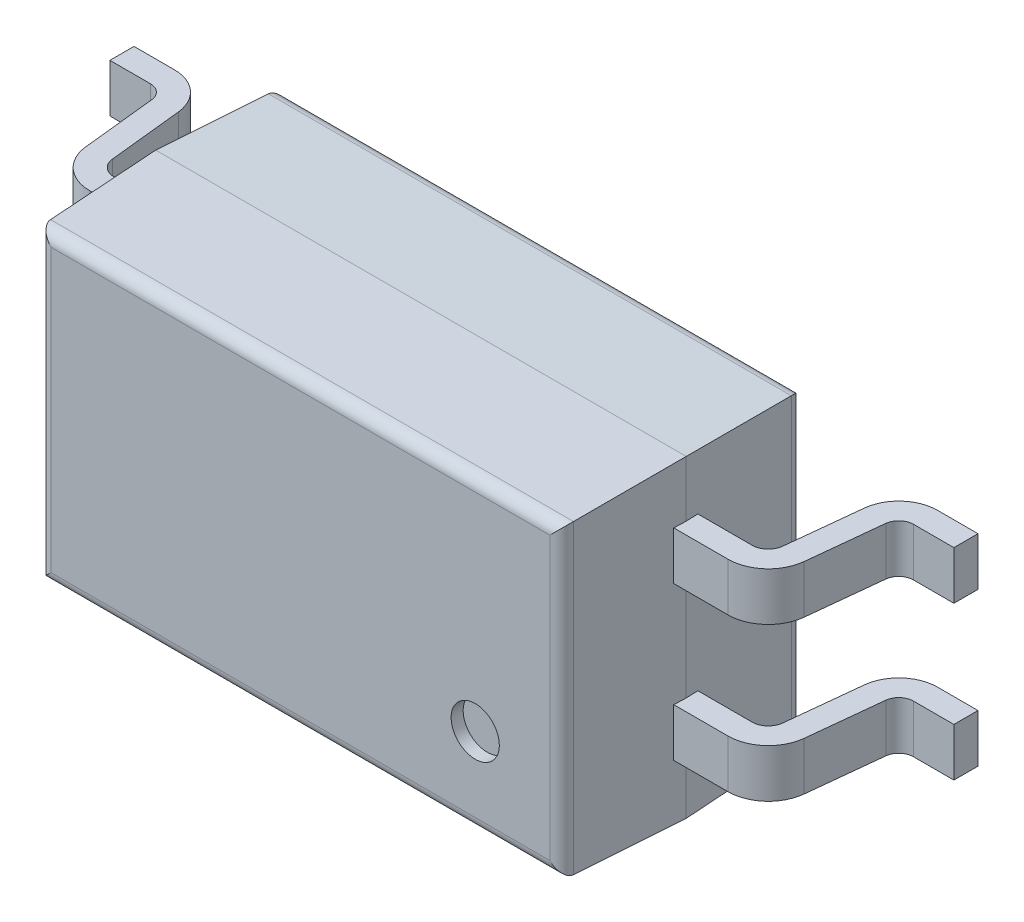
from build123d import *
from OCP.BRepFilletAPI import BRepFilletAPI_MakeChamfer

# Parameters (mm, degrees)
ESQUISSE1_W             = 4.4
ESQUISSE1_H             = 2.6
BOSS_EXTRU_1_DEPTH      = 2
CHANFREIN1_SIZE         = 1
CHANFREIN1_SIZE2        = 0.034921
CHANFREIN2_SIZE         = 0.034921
CHANFREIN2_SIZE_2       = 1
ESQUISSE2_R             = 0.2
ENL_V_MAT_EXTRU_1_DEPTH = 0.1
ESQUISSE3_W             = 0.3
ESQUISSE3_H             = 0.3
ENL_V_MAT_EXTRU_2_DEPTH = 6.488169
BOSS_EXTRU_2_DEPTH      = 0.000834
BOSS_EXTRU_2_DEPTH_BACK = 4.399166
ESQUISSE4_W             = 0.2
ESQUISSE4_H             = 0.4
ESQUISSE5_W             = 1.22
ESQUISSE5_H             = 0.4
BOSS_EXTRU_3_DEPTH      = 1.3
BOSS_EXTRU_4_OUTLINE_W  = 1.22
BOSS_EXTRU_4_OUTLINE_H  = 0.4
BOSS_EXTRU_4_DEPTH      = 1.3
ENL_V_MAT_EXTRU_3_DEPTH = 7.406889
CONG_1_R                = 0.1
CONG_2_R                = 0.1


with BuildPart() as part:
    # Esquisse1 → Boss.-Extru.1 (new body)
    with BuildSketch(Plane.XY):
        with Locations((2.2, 1.3)):
            Rectangle(ESQUISSE1_W, ESQUISSE1_H)
    extrude(amount=BOSS_EXTRU_1_DEPTH)

    # Chanfrein1: one chamfer whose edges measure the first distance from different faces: ONE call of the kernel's chamfer builder (chamfer() names one face for all edges)
    chanfrein1_edges_1 = [part.edges().sort_by_distance(p)[0] for p in [
        (0, 1.3, 2),
    ]]
    chanfrein1_side_1 = [part.faces().sort_by_distance(p)[0] for p in [
        (0, 1.3, 1),
    ]]
    chanfrein1_edges_2 = [part.edges().sort_by_distance(p)[0] for p in [
        (2.2, 0, 2),
    ]]
    chanfrein1_side_2 = [part.faces().sort_by_distance(p)[0] for p in [
        (2.2, 0, 1),
    ]]
    chanfrein1_edges_3 = [part.edges().sort_by_distance(p)[0] for p in [
        (4.4, 1.3, 2),
    ]]
    chanfrein1_side_3 = [part.faces().sort_by_distance(p)[0] for p in [
        (4.4, 1.3, 1),
    ]]
    chanfrein1_edges_4 = [part.edges().sort_by_distance(p)[0] for p in [
        (2.2, 2.6, 2),
    ]]
    chanfrein1_side_4 = [part.faces().sort_by_distance(p)[0] for p in [
        (2.2, 2.6, 1),
    ]]
    chanfrein1 = BRepFilletAPI_MakeChamfer(part.part.solid().wrapped)
    for e in chanfrein1_edges_1:
        chanfrein1.Add(CHANFREIN1_SIZE, CHANFREIN1_SIZE2, e.wrapped, chanfrein1_side_1[0].wrapped)  # the first distance lies on this face
    for e in chanfrein1_edges_2:
        chanfrein1.Add(CHANFREIN1_SIZE, CHANFREIN1_SIZE2, e.wrapped, chanfrein1_side_2[0].wrapped)  # the first distance lies on this face
    for e in chanfrein1_edges_3:
        chanfrein1.Add(CHANFREIN1_SIZE, CHANFREIN1_SIZE2, e.wrapped, chanfrein1_side_3[0].wrapped)  # the first distance lies on this face
    for e in chanfrein1_edges_4:
        chanfrein1.Add(CHANFREIN1_SIZE, CHANFREIN1_SIZE2, e.wrapped, chanfrein1_side_4[0].wrapped)  # the first distance lies on this face
    add(Compound.cast(chanfrein1.Shape()), mode=Mode.REPLACE)

    # Chanfrein2
    chanfrein2_edges_1 = [part.edges().sort_by_distance(p)[0] for p in [
        (2.2, 0, 0),
    ]]
    chanfrein2_side_1 = [part.faces().sort_by_distance(p)[0] for p in [
        (2.2, 0.000698, 0),
    ]]
    chanfrein2_edges_2 = [part.edges().sort_by_distance(p)[0] for p in [
        (4.4, 1.3, 0),
    ]]
    chanfrein2_side_2 = [part.faces().sort_by_distance(p)[0] for p in [
        (4.4, 1.3, 0.000698),
    ]]
    chanfrein2_edges_3 = [part.edges().sort_by_distance(p)[0] for p in [
        (2.2, 2.6, 0),
    ]]
    chanfrein2_side_3 = [part.faces().sort_by_distance(p)[0] for p in [
        (2.2, 2.6, 0.000698),
    ]]
    chanfrein2_edges_4 = [part.edges().sort_by_distance(p)[0] for p in [
        (0, 1.3, 0),
    ]]
    chanfrein2_side_4 = [part.faces().sort_by_distance(p)[0] for p in [
        (0.000698, 1.3, 0),
    ]]
    chanfrein2 = BRepFilletAPI_MakeChamfer(part.part.solid().wrapped)
    for e in chanfrein2_edges_1:
        chanfrein2.Add(CHANFREIN2_SIZE - 0.0001, CHANFREIN2_SIZE_2 - 0.0001, e.wrapped, chanfrein2_side_1[0].wrapped)
    for e in chanfrein2_edges_2:
        chanfrein2.Add(CHANFREIN2_SIZE_2 - 0.0001, CHANFREIN2_SIZE - 0.0001, e.wrapped, chanfrein2_side_2[0].wrapped)
    for e in chanfrein2_edges_3:
        chanfrein2.Add(CHANFREIN2_SIZE_2 - 0.0001, CHANFREIN2_SIZE - 0.0001, e.wrapped, chanfrein2_side_3[0].wrapped)
    for e in chanfrein2_edges_4:
        chanfrein2.Add(CHANFREIN2_SIZE - 0.0001, CHANFREIN2_SIZE_2 - 0.0001, e.wrapped, chanfrein2_side_4[0].wrapped)
    add(Compound.cast(chanfrein2.Shape()), mode=Mode.REPLACE)  # a hair under: the kernel refuses the full size

    # Esquisse2 → Enlèv. mat.-Extru.1 (cut)
    with BuildSketch(Plane.XY.offset(2)):
        with Locations((3.65, 0.75)):
            Circle(ESQUISSE2_R)
    extrude(amount=-ENL_V_MAT_EXTRU_1_DEPTH, mode=Mode.SUBTRACT)

    # Esquisse3 → Enlèv. mat.-Extru.2 (cut, through all)
    with BuildSketch(Plane.XY.offset(2)):
        with Locations((4.549166, 1.921549)):
            Rectangle(ESQUISSE3_W, ESQUISSE3_H)
        with Locations((-0.149629, 1.921549)):
            Rectangle(ESQUISSE3_W, ESQUISSE3_H)
    extrude(amount=-ENL_V_MAT_EXTRU_2_DEPTH, mode=Mode.SUBTRACT)

    # Esquisse4 → Boss.-Extru.2 (add, two sides: drawn at the far end of the back side and taken through both)
    with BuildSketch(Plane(origin=(4.399166, 0, 0), x_dir=(0, 0, -1), z_dir=(1, 0, 0)).offset(-BOSS_EXTRU_2_DEPTH_BACK)):
        Polygon((-1.1, 2.135), (-1, 2.135), (-0.9, 2.135), (-0.9, 1.735), (-1.1, 1.735), align=None)
        with Locations((-1, 0.665)):
            Rectangle(ESQUISSE4_W, ESQUISSE4_H)
    extrude(amount=BOSS_EXTRU_2_DEPTH + BOSS_EXTRU_2_DEPTH_BACK)

    # Esquisse5 → Boss.-Extru.3 (add)
    with BuildSketch(Plane.ZY):
        with Locations((0.49, 0.665)):
            Rectangle(ESQUISSE5_W, ESQUISSE5_H)
        with Locations((0.49, 1.935)):
            Rectangle(ESQUISSE5_W, ESQUISSE5_H)
    extrude(amount=BOSS_EXTRU_3_DEPTH)

    # Boss.-Extru.4: read off the stored shape, not the designer's step
    # Boss.-Extru.4 outline → Boss.-Extru.4 (add)
    with BuildSketch(Plane(origin=(4.4, 0, 0), x_dir=(0, 0, -1), z_dir=(1, 0, 0))):
        with Locations((-0.49, 1.935)):
            Rectangle(BOSS_EXTRU_4_OUTLINE_W, BOSS_EXTRU_4_OUTLINE_H)
        with Locations((-0.49, 0.665)):
            Rectangle(BOSS_EXTRU_4_OUTLINE_W, BOSS_EXTRU_4_OUTLINE_H)
    extrude(amount=BOSS_EXTRU_4_DEPTH)

    # Esquisse7 → Enlèv. mat.-Extru.3 (cut, through all)
    with BuildSketch(Plane.XZ.offset(-0.465)):
        with BuildLine():
            Line((0, 0.9), (-0.446508, 0.9))
            ThreePointArc((-0.446508, 0.9), (-0.536245, 0.865574), (-0.579932, 0.779961))
            Line((-0.579932, 0.779961), (-0.644812, 0.167386))
            ThreePointArc((-0.644812, 0.167386), (-0.749402, -0.037579), (-0.964243, -0.12))
            Line((-0.964243, -0.12), (0, -0.12))
            Line((0, -0.12), (0, 0.9))
        make_face()
        with BuildLine():
            Line((-1.3, 0.08), (-0.964243, 0.08))
            ThreePointArc((-0.964243, 0.08), (-0.883169, 0.111103), (-0.843699, 0.188451))
            Line((-0.843699, 0.188451), (-0.778819, 0.801026))
            ThreePointArc((-0.778819, 0.801026), (-0.670012, 1.014256), (-0.446508, 1.1))
            Line((-0.446508, 1.1), (-1.3, 1.1))
            Line((-1.3, 1.1), (-1.3, 0.08))
        make_face()
        with BuildLine():
            Line((4.4, -0.12), (5.364243, -0.12))
            ThreePointArc((5.364243, -0.12), (5.149402, -0.037579), (5.044812, 0.167386))
            Line((5.044812, 0.167386), (4.979932, 0.779961))
            ThreePointArc((4.979932, 0.779961), (4.936245, 0.865574), (4.846508, 0.9))
            Line((4.846508, 0.9), (4.4, 0.9))
            Line((4.4, 0.9), (4.4, -0.12))
        make_face()
        with BuildLine():
            Line((5.7, 1.1), (4.846508, 1.1))
            ThreePointArc((4.846508, 1.1), (5.070012, 1.014256), (5.178819, 0.801026))
            Line((5.178819, 0.801026), (5.243699, 0.188451))
            ThreePointArc((5.243699, 0.188451), (5.283169, 0.111103), (5.364243, 0.08))
            Line((5.364243, 0.08), (5.7, 0.08))
            Line((5.7, 0.08), (5.7, 1.1))
        make_face()
    extrude(amount=-ENL_V_MAT_EXTRU_3_DEPTH, mode=Mode.SUBTRACT)

    # Congé1
    cong_1_edges = [part.edges().sort_by_distance(p)[0] for p in [
        (2.2, 2.565079, 2),
        (4.365079, 1.3, 2),
        (0.034921, 1.3, 2),
        (2.2, 0.034921, 2),
    ]]
    fillet(cong_1_edges, radius=CONG_1_R)

    # Congé2
    cong_2_edges = [part.edges().sort_by_distance(p)[0] for p in [
        (0.034821, 1.3, 0),
        (2.2, 2.565179, 0),
        (4.365179, 1.3, 0),
        (2.2, 0.034821, 0),
    ]]
    fillet(cong_2_edges, radius=CONG_2_R)


solid = part.part
